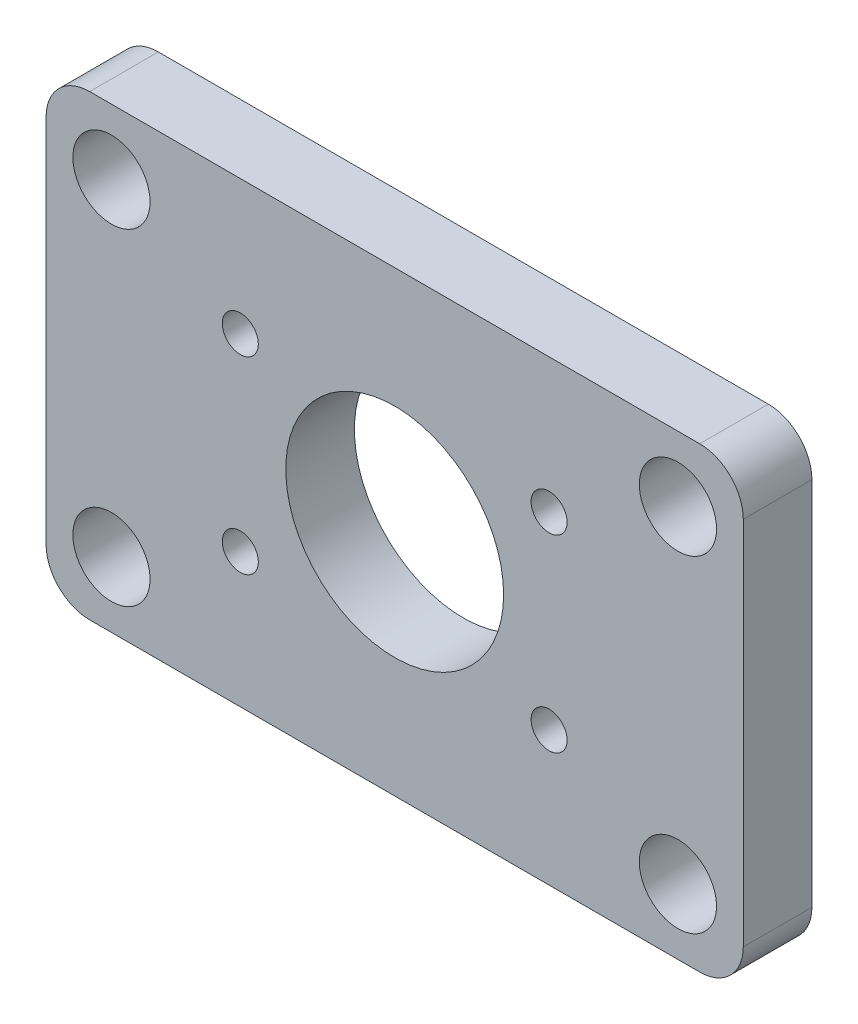
from build123d import *

# Parameters (mm, degrees)
SKETCH1_W           = 40.64
SKETCH1_H           = 26.67
SKETCH1_R           = 2.25
SKETCH1_R_2         = 1.05
SKETCH1_R_3         = 6.35
BOSS_EXTRUDE1_DEPTH = 4
FILLET1_R           = 2.54


with BuildPart() as part:
    # Sketch1 → Boss-Extrude1 (new body)
    with BuildSketch(Plane.XY):
        Rectangle(SKETCH1_W, SKETCH1_H)
        with Locations((-16.51, 9.525)):
            Circle(SKETCH1_R, mode=Mode.SUBTRACT)
        with Locations((16.51, 9.525)):
            Circle(SKETCH1_R, mode=Mode.SUBTRACT)
        with Locations((16.51, -9.525)):
            Circle(SKETCH1_R, mode=Mode.SUBTRACT)
        with Locations((-16.51, -9.525)):
            Circle(SKETCH1_R, mode=Mode.SUBTRACT)
        with Locations((-9.00049, 5.50037)):
            Circle(SKETCH1_R_2, mode=Mode.SUBTRACT)
        with Locations((9.00049, -5.50037)):
            Circle(SKETCH1_R_2, mode=Mode.SUBTRACT)
        Circle(SKETCH1_R_3, mode=Mode.SUBTRACT)
        with Locations((-9.00049, -5.50037)):
            Circle(SKETCH1_R_2, mode=Mode.SUBTRACT)
        with Locations((9.00049, 5.50037)):
            Circle(SKETCH1_R_2, mode=Mode.SUBTRACT)
    extrude(amount=BOSS_EXTRUDE1_DEPTH)

    # Fillet1
    fillet1_edges = [part.edges().sort_by_distance(p)[0] for p in [
        (20.32, 13.335, 2),
        (20.32, -13.335, 2),
        (-20.32, -13.335, 2),
        (-20.32, 13.335, 2),
    ]]
    fillet(fillet1_edges, radius=FILLET1_R)


solid = part.part
